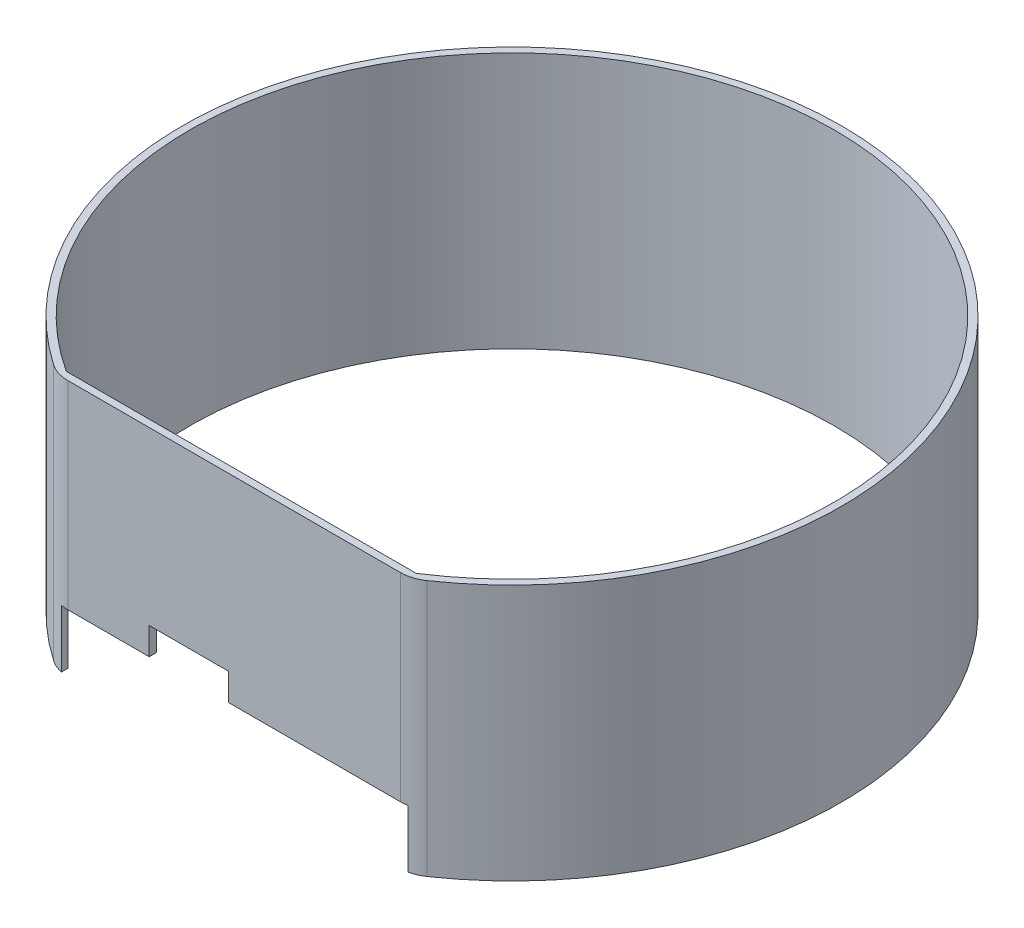
from build123d import *

# Parameters (mm, degrees)
BOSS_EXTRUDE1_DEPTH = 71
FILLET1_R           = 10
SKETCH2_W           = 96
SKETCH2_H           = 16
CUT_EXTRUDE1_DEPTH  = 5
SKETCH3_W           = 22
SKETCH3_H           = 7.5
CUT_EXTRUDE2_DEPTH  = 5


with BuildPart() as part:
    # Sketch1 → Boss-Extrude1 (new body)
    with BuildSketch(Plane(origin=(0, 0, 0), x_dir=(1, 0, 0), z_dir=(0, 1, 0))):
        with BuildLine():
            Line((-49.058026866, -77), (49.058026866, -77))
            ThreePointArc((49.058026866, -77), (0, 91.3), (-49.058026866, -77))
        make_face()
        with BuildLine():
            Line((-48.47153804, -75), (48.47153804, -75))
            ThreePointArc((48.47153804, -75), (0, 89.3), (-48.47153804, -75))
        make_face(mode=Mode.SUBTRACT)
    extrude(amount=BOSS_EXTRUDE1_DEPTH)

    # Fillet1
    fillet1_edges = [part.edges().sort_by_distance(p)[0] for p in [
        (-49.058026866, 35.5, 77),
        (49.058026866, 35.5, 77),
    ]]
    fillet(fillet1_edges, radius=FILLET1_R)

    # Sketch2 → Cut-Extrude1 (cut)
    with BuildSketch(Plane.XY.offset(77)):
        with Locations((0, 8)):
            Rectangle(SKETCH2_W, SKETCH2_H)
    extrude(amount=-CUT_EXTRUDE1_DEPTH, mode=Mode.SUBTRACT)

    # Sketch3 → Cut-Extrude2 (cut)
    with BuildSketch(Plane.XY.offset(77)):
        with Locations((-12.5, 19.75)):
            Rectangle(SKETCH3_W, SKETCH3_H)
    extrude(amount=-CUT_EXTRUDE2_DEPTH, mode=Mode.SUBTRACT)


solid = part.part
